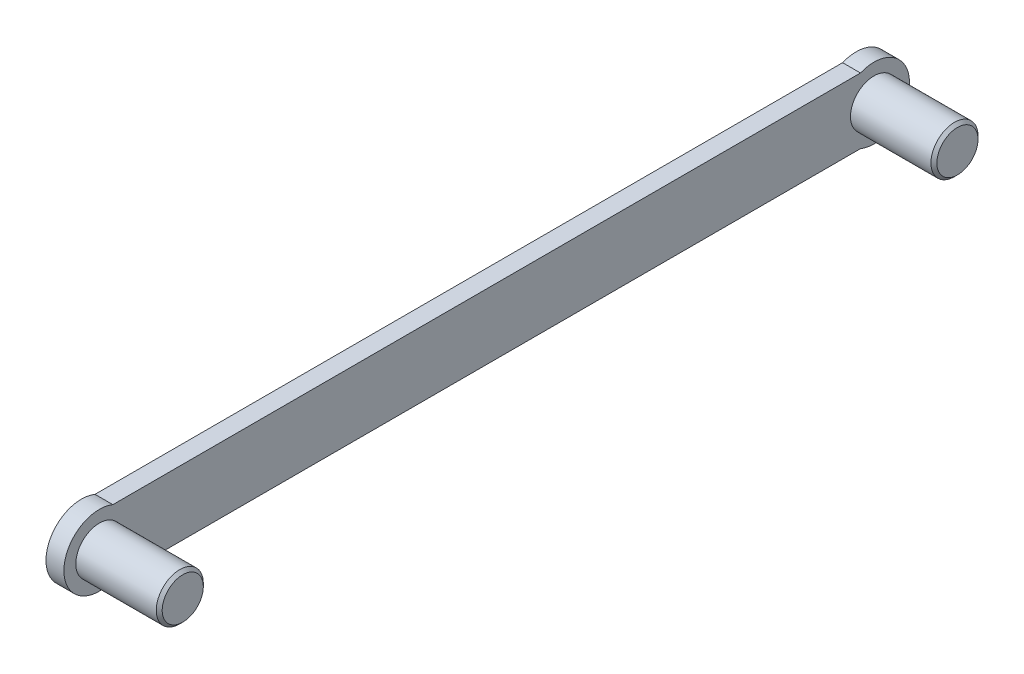
from build123d import *

# Parameters (mm, degrees)
SKETCH1_R             = 3.95
BOSS_EXTRUDE1_DEPTH   = 17
BOSS_EXTRUDE1_2_DEPTH = 17
BOSS_EXTRUDE3_DEPTH   = 3
CHAMFER1_SIZE         = 0.5


with BuildPart() as part:
    # Sketch1 → Boss-Extrude1 (new body)
    with BuildSketch(Plane(origin=(0, 0, 0), x_dir=(0, 0, -1), z_dir=(1, 0, 0))):
        with Locations((-89.17195507, -2.222841681)):
            Circle(SKETCH1_R)
    extrude(amount=BOSS_EXTRUDE1_DEPTH)



with BuildPart() as body_2:
    # Sketch1 → Boss-Extrude1 2 (new body)
    with BuildSketch(Plane(origin=(0, 0, 0), x_dir=(0, 0, -1), z_dir=(1, 0, 0))):
        with Locations((40.82804493, -2.222841681)):
            Circle(SKETCH1_R)
    extrude(amount=BOSS_EXTRUDE1_2_DEPTH)


with BuildPart() as part_1:
    add(part.part)

    add(body_2.part)  # Boss-Extrude3 merges body 2
    # Sketch1<4> → Boss-Extrude3 (add)
    with BuildSketch(Plane(origin=(0, 0, 0), x_dir=(0, 0, -1), z_dir=(1, 0, 0))):
        with BuildLine():
            ThreePointArc((-86.902043177, 3.277158319), (-95.12195507, -2.222841681), (-86.902043177, -7.722841681))
            Line((-86.902043177, -7.722841681), (38.558133038, -7.722841681))
            ThreePointArc((38.558133038, -7.722841681), (46.77804493, -2.222841681), (38.558133038, 3.277158319))
            Line((38.558133038, 3.277158319), (-86.902043177, 3.277158319))
        make_face()
    extrude(amount=BOSS_EXTRUDE3_DEPTH)

    # Chamfer1
    chamfer1_edges = [part_1.edges().sort_by_distance(p)[0] for p in [
        (17, -2.222841681, 93.12195507),
        (17, -2.222841681, -36.87804493),
    ]]
    chamfer(chamfer1_edges, length=CHAMFER1_SIZE)


solid = part_1.part
